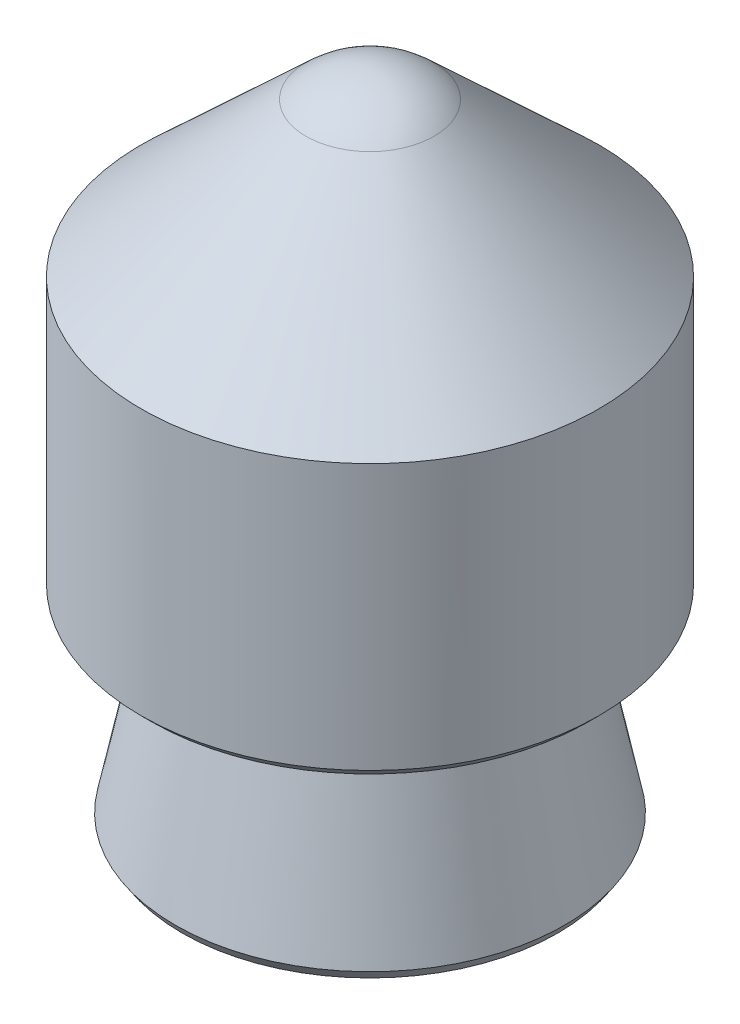
from build123d import *
from OCP.BRepFilletAPI import BRepFilletAPI_MakeChamfer

# Parameters (mm, degrees)
CHAMFER1_SIZE              = 0.254
CHAMFER1_SIZE2             = 0.215388858
SKETCH4_R                  = 3.5
CUT_EXTRUDE1_DEPTH         = 2.5
M7X0_75_TAPPED_HOLE1_D     = 6
M7X0_75_TAPPED_HOLE1_DEPTH = 10.922
M7X0_75_TAPPED_HOLE1_TIP   = 1.802581857


with BuildPart() as part:
    # Sketch1 → Revolve1 (revolve)
    with BuildSketch(Plane.XY):
        with BuildLine():
            Line((0, 25.4), (-4.80695, 25.4))
            Line((-4.80695, 25.4), (-3.8227, 30.2387))
            Line((-3.8227, 30.2387), (-5.588, 30.2387))
            Line((-5.588, 30.2387), (-5.588, 36.9824))
            Line((-5.588, 36.9824), (-1.563367534, 40.735379295))
            ThreePointArc((-1.563367534, 40.735379295), (-0.840141831, 41.19169557), (0, 41.3512))
            Line((0, 41.3512), (0, 25.4))
        make_face()
    revolve(axis=Axis((0, 25.4, 0), (0, 1, 0)))

    # Chamfer1: one chamfer whose edges measure the first distance from different faces: ONE call of the kernel's chamfer builder (chamfer() names one face for all edges)
    chamfer1_edges_1 = [part.edges().sort_by_distance(p)[0] for p in [
        (4.80695, 25.4, 0),
    ]]
    chamfer1_side_1 = [part.faces().sort_by_distance(p)[0] for p in [
        (4.314825, 27.81935, 0),
    ]]
    chamfer1_edges_2 = [part.edges().sort_by_distance(p)[0] for p in [
        (5.588, 30.2387, 0),
    ]]
    chamfer1 = BRepFilletAPI_MakeChamfer(part.part.solid().wrapped)
    for e in chamfer1_edges_1:
        chamfer1.Add(CHAMFER1_SIZE, CHAMFER1_SIZE2, e.wrapped, chamfer1_side_1[0].wrapped)  # the first distance lies on this face
    for e in chamfer1_edges_2:
        chamfer1.Add(CHAMFER1_SIZE, e.wrapped)
    add(Compound.cast(chamfer1.Shape()), mode=Mode.REPLACE)

    # Sketch4 → Cut-Extrude1 (cut)
    with BuildSketch(Plane.XZ.offset(-25.4)):
        Circle(SKETCH4_R)
    extrude(amount=-CUT_EXTRUDE1_DEPTH, mode=Mode.SUBTRACT)

    # M7x0.75 Tapped Hole1
    with Locations(Plane(origin=(0, 25.4, 0), x_dir=(-1, 0, 0), z_dir=(0, -1, 0))):
        with Locations((0, 0), (96.139395676, -180.684699687)):
            Hole(M7X0_75_TAPPED_HOLE1_D / 2, depth=M7X0_75_TAPPED_HOLE1_DEPTH)
            with Locations((0, 0, -(M7X0_75_TAPPED_HOLE1_DEPTH + M7X0_75_TAPPED_HOLE1_TIP / 2))):  # 118° drill point
                Cone(0, M7X0_75_TAPPED_HOLE1_D / 2, M7X0_75_TAPPED_HOLE1_TIP, mode=Mode.SUBTRACT)


solid = part.part
